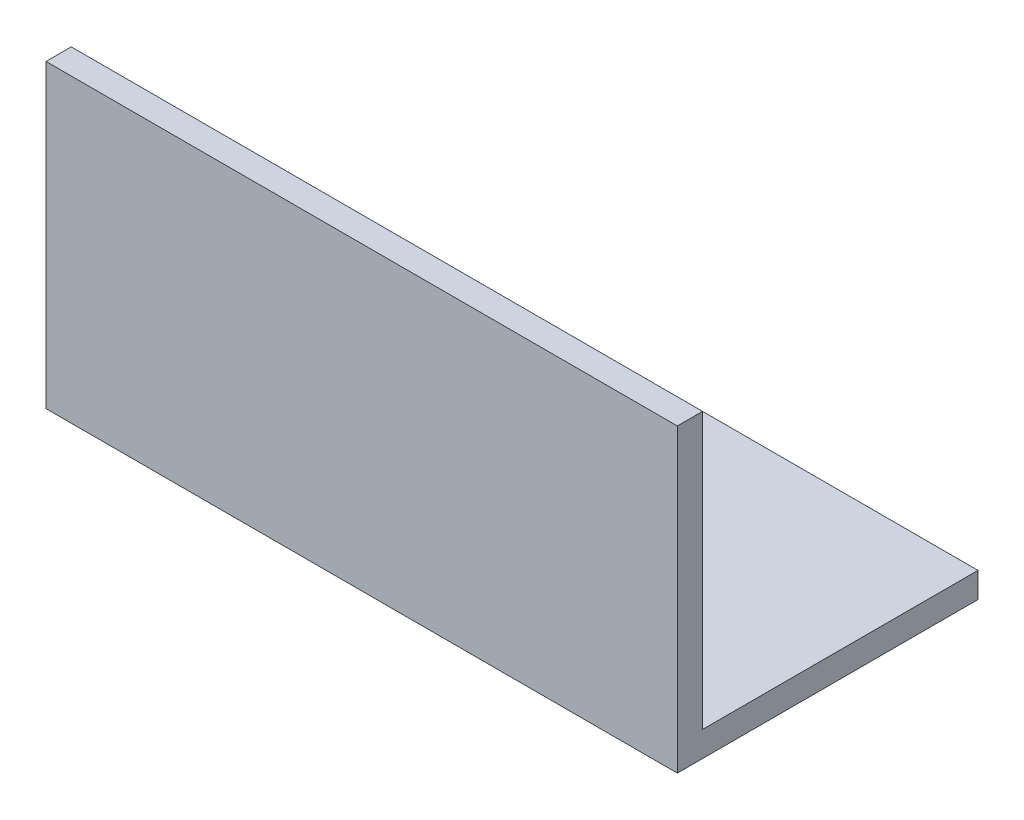
from build123d import *

# Parameters (mm, degrees)
BOSS_EXTRUDE1_DEPTH = 20


with BuildPart() as part:
    # Sketch1 → Boss-Extrude1 (new, symmetric)
    with BuildSketch(Plane(origin=(0, 0, 0), x_dir=(0, 0, -1), z_dir=(1, 0, 0))):
        Polygon((0, 0), (0, 19.05), (1.6, 19.05), (1.6, 1.6), (19.05, 1.6), (19.05, 0), align=None)
    extrude(amount=BOSS_EXTRUDE1_DEPTH, both=True)


solid = part.part
